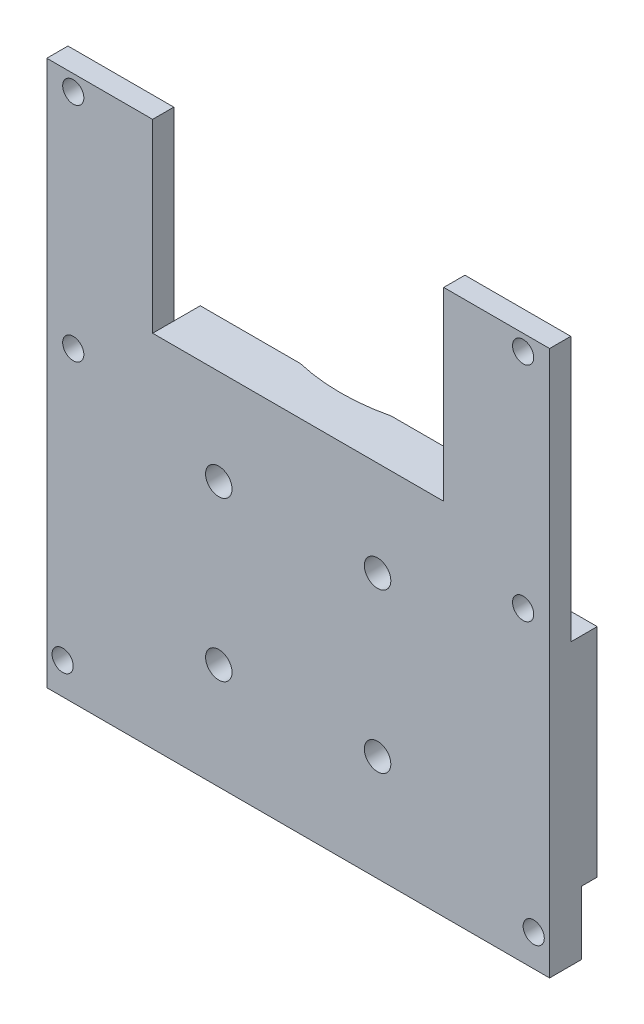
from build123d import *

# Parameters (mm, degrees)
SKETCH1_R                = 37.5
BOSS_EXTRUDE1_DEPTH      = 12
SKETCH2_R                = 30
BOSS_EXTRUDE2_DEPTH      = 56
BOSS_EXTRUDE3_DEPTH      = 5
BOSS_EXTRUDE3_DEPTH_BACK = 1
SKETCH4_W                = 75
SKETCH4_H                = 15
SKETCH4_R                = 3.5
MOVE_FACE3_BY            = 10
MOVE_FACE3_2_BY          = 10
BOSS_EXTRUDE4_DEPTH      = 12
BOSS_EXTRUDE5_DEPTH      = 68
MOVE_FACE1_BY            = 10
SKETCH11_W               = 95
SKETCH11_H               = 15
BOSS_EXTRUDE7_DEPTH      = 20
CUT_EXTRUDE1_DEPTH       = 103.720494547
CUT_EXTRUDE1_DEPTH_BACK  = 103.720494547
SKETCH12_R               = 2.5
SKETCH13_R               = 6.5
CUT_EXTRUDE2_DEPTH       = 5
MOVE_FACE2_BY            = 7
DELETEFACE1_START        = -20
DELETEFACE1_OUTLINE_W    = 95
DELETEFACE1_OUTLINE_H    = 8
DELETEFACE1_DEPTH        = 20
CUT_EXTRUDE3_DEPTH       = 103.359660059
CUT_EXTRUDE3_DEPTH_BACK  = 3
SKETCH15_R               = 2
CUT_EXTRUDE4_DEPTH       = 96.818839484
MOVE_FACE4_BY            = 20
SKETCH16_W               = 55
SKETCH16_H               = 35
CUT_EXTRUDE5_DEPTH       = 10
SKETCH17_W               = 20
SKETCH17_H               = 50
CUT_EXTRUDE6_DEPTH       = 5
SKETCH18_R               = 2
CUT_EXTRUDE7_DEPTH       = 114.535236825


# Read off the part's stored shape, not the designer's step: DeleteFace1
with BuildPart() as part:
    # Sketch1 → Boss-Extrude1 (new body)
    with BuildSketch(Plane(origin=(0, 0, 0), x_dir=(1, 0, 0), z_dir=(0, 1, 0))):
        with Locations(Location((0, 0, 0), (0, 0, 270))):
            Circle(SKETCH1_R)
    extrude(amount=BOSS_EXTRUDE1_DEPTH)

    # Sketch2 → Boss-Extrude2 (add)
    with BuildSketch(Plane(origin=(0, 12, 0), x_dir=(1, 0, 0), z_dir=(0, 1, 0))):
        with Locations(Location((0, 0, 0), (0, 0, 270))):
            Circle(SKETCH2_R)
    extrude(amount=BOSS_EXTRUDE2_DEPTH)


with BuildPart() as body_2:
    # Sketch4 → Boss-Extrude3 (new, two sides: drawn at the far end of the back side and taken through both)
    with BuildSketch(Plane.XY.offset(37.5).offset(-BOSS_EXTRUDE3_DEPTH_BACK)):
        with Locations((0, 75.5)):
            Rectangle(SKETCH4_W, SKETCH4_H)
        with Locations((0, 76)):
            Circle(SKETCH4_R, mode=Mode.SUBTRACT)
    extrude(amount=BOSS_EXTRUDE3_DEPTH + BOSS_EXTRUDE3_DEPTH_BACK)

    # Move Face3: a face moved outward by 10.0
    extrude(body_2.faces().sort_by_distance((-37.5, 75.5, 39.5))[0], amount=MOVE_FACE3_BY, dir=(-1, 0, 0))

    # Move Face3 2: a face moved outward by 10.0
    extrude(body_2.faces().sort_by_distance((37.5, 75.5, 39.5))[0], amount=MOVE_FACE3_2_BY, dir=(1, 0, 0))



with BuildPart() as body_3:
    # Sketch6 → Boss-Extrude4 (new body)
    with BuildSketch(Plane.XZ):
        with BuildLine():
            Line((42.5, 0), (37.5, 0))
            ThreePointArc((37.5, 0), (0, 37.5), (-37.5, 0))
            Line((-37.5, 0), (-42.5, 0))
            ThreePointArc((-42.5, 0), (0, 42.5), (42.5, 0))
        make_face()
    extrude(amount=-BOSS_EXTRUDE4_DEPTH)


with BuildPart() as body_2_1:
    add(body_2.part)

    add(body_3.part)  # Boss-Extrude5 merges body 3
    # Sketch7 → Boss-Extrude5 (add)
    with BuildSketch(Plane.XZ.offset(-68)):
        with BuildLine():
            Line((8.602325267, 36.5), (47.5, 36.5))
            Line((47.5, 36.5), (47.5, 42.5))
            Line((47.5, 42.5), (-47.5, 42.5))
            Line((-47.5, 42.5), (-47.5, 36.5))
            Line((-47.5, 36.5), (-8.602325267, 36.5))
            ThreePointArc((-8.602325267, 36.5), (0, 37.5), (8.602325267, 36.5))
        make_face()
    extrude(amount=BOSS_EXTRUDE5_DEPTH)

    # Move Face1: a face moved outward by 10.0
    extrude(body_2_1.faces().sort_by_distance((0, 41.330789145, 42.5))[0], amount=MOVE_FACE1_BY, dir=(0, 0, 1))

    # Sketch11 → Boss-Extrude7 (add)
    with BuildSketch(Plane.XZ):
        with Locations((0, 45)):
            Rectangle(SKETCH11_W, SKETCH11_H)
    extrude(amount=BOSS_EXTRUDE7_DEPTH)

    # Sketch12 → Cut-Extrude1 (cut, two sides: drawn at the far end of the back side and taken through both)
    with BuildSketch(Plane(origin=(0, 0, 37.5), x_dir=(-1, 0, 0), z_dir=(0, 0, -1)).offset(-CUT_EXTRUDE1_DEPTH_BACK)):
        with Locations((-15, 20)):
            Circle(SKETCH12_R)
        with Locations((15, 20)):
            Circle(SKETCH12_R)
        with Locations((-15, 50)):
            Circle(SKETCH12_R)
        with Locations((15, 50)):
            Circle(SKETCH12_R)
    extrude(amount=CUT_EXTRUDE1_DEPTH + CUT_EXTRUDE1_DEPTH_BACK, mode=Mode.SUBTRACT)

    # Sketch13 → Cut-Extrude2 (cut)
    with BuildSketch(Plane(origin=(0, 0, 36.5), x_dir=(-1, 0, 0), z_dir=(0, 0, -1))):
        with Locations((-15, 50)):
            Circle(SKETCH13_R)
        with Locations((15, 50)):
            Circle(SKETCH13_R)
        with Locations((-15, 20)):
            Circle(SKETCH13_R)
        with Locations((15, 20)):
            Circle(SKETCH13_R)
    extrude(amount=-CUT_EXTRUDE2_DEPTH, mode=Mode.SUBTRACT)

    # Move Face2: a face moved inward by 7.0
    extrude(body_2_1.faces().sort_by_distance((0, 31.294429556, 52.5))[0], amount=MOVE_FACE2_BY, dir=(0, 0, -1), mode=Mode.SUBTRACT)

    # DeleteFace1 outline → DeleteFace1 (cut)
    with BuildSketch(Plane(origin=(0, 0, 0), x_dir=(1, 0, 0), z_dir=(0, 1, 0)).offset(DELETEFACE1_START)):
        with Locations((0, -41.5)):
            Rectangle(DELETEFACE1_OUTLINE_W, DELETEFACE1_OUTLINE_H)
    extrude(amount=DELETEFACE1_DEPTH, mode=Mode.SUBTRACT)

    # Sketch14 → Cut-Extrude3 (cut, two sides: drawn at the far end of the back side and taken through both)
    with BuildSketch(Plane(origin=(0, 0, 36.5), x_dir=(-1, 0, 0), z_dir=(0, 0, -1)).offset(-CUT_EXTRUDE3_DEPTH_BACK)):
        Polygon((47.5, 0), (-42.5, 0), (-47.5, 0), (-47.5, 12), (-42.5, 12), (47.5, 12), align=None)
    extrude(amount=CUT_EXTRUDE3_DEPTH + CUT_EXTRUDE3_DEPTH_BACK, mode=Mode.SUBTRACT)

    # Sketch15 → Cut-Extrude4 (cut, through all)
    with BuildSketch(Plane(origin=(0, 0, 39.5), x_dir=(-1, 0, 0), z_dir=(0, 0, -1))):
        with Locations((44.5, 6)):
            Circle(SKETCH15_R)
        with Locations((-44.5, 6)):
            Circle(SKETCH15_R)
    extrude(amount=-CUT_EXTRUDE4_DEPTH, mode=Mode.SUBTRACT)

    # Move Face4: a face moved outward by 20.0
    extrude(body_2_1.faces().sort_by_distance((0, 83, 41))[0], amount=MOVE_FACE4_BY, dir=(0, 1, 0))

    # Sketch16 → Cut-Extrude5 (cut)
    with BuildSketch(Plane(origin=(0, 0, 36.5), x_dir=(-1, 0, 0), z_dir=(0, 0, -1))):
        with Locations((0, 85.5)):
            Rectangle(SKETCH16_W, SKETCH16_H)
    extrude(amount=-CUT_EXTRUDE5_DEPTH, mode=Mode.SUBTRACT)

    # Sketch17 → Cut-Extrude6 (cut)
    with BuildSketch(Plane(origin=(0, 0, 36.5), x_dir=(-1, 0, 0), z_dir=(0, 0, -1))):
        with Locations((37.5, 78)):
            Rectangle(SKETCH17_W, SKETCH17_H)
        with Locations((-37.5, 78)):
            Rectangle(SKETCH17_W, SKETCH17_H)
    extrude(amount=-CUT_EXTRUDE6_DEPTH, mode=Mode.SUBTRACT)

    # Sketch18 → Cut-Extrude7 (cut, through all)
    with BuildSketch(Plane(origin=(0, 0, 41.5), x_dir=(-1, 0, 0), z_dir=(0, 0, -1))):
        with Locations((-42.5, 58)):
            Circle(SKETCH18_R)
        with Locations((-42.5, 100)):
            Circle(SKETCH18_R)
        with Locations(Location((42.5, 100, 0), (0, 0, 180))):
            Circle(SKETCH18_R)
        with Locations(Location((42.5, 58, 0), (0, 0, 180))):
            Circle(SKETCH18_R)
    extrude(amount=-CUT_EXTRUDE7_DEPTH, mode=Mode.SUBTRACT)


solid = body_2_1.part
